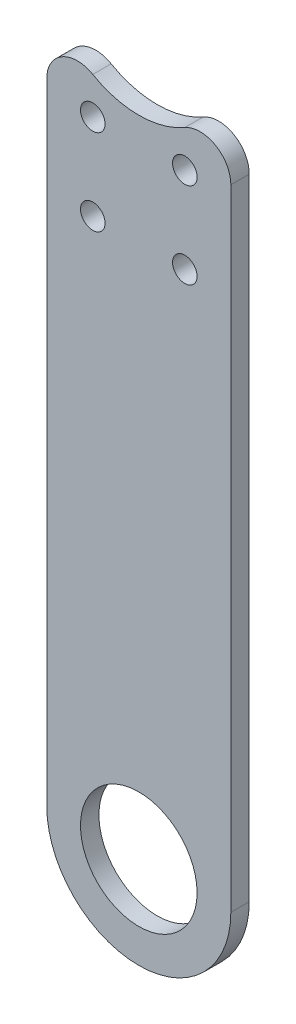
from build123d import *

# Parameters (mm, degrees)
SKETCH_1_R          = 9.5
EXTRUDE_1_DEPTH     = 3
FILLET_START        = -1
FILLET_2_DEPTH      = 5
SKETCH_2_R          = 2
CUT_EXTRUDE_1_DEPTH = 10


with BuildPart() as part:
    # 草图1 → 凸台-拉伸1 (new body)
    with BuildSketch(Plane.XY):
        with BuildLine():
            Line((-15, 0), (-15, -120))
            ThreePointArc((-15, -120), (0, -135), (15, -120))
            Line((15, -120), (15, 0))
            ThreePointArc((15, 0), (0, -15), (-15, 0))
        make_face()
        with Locations((0, -120)):
            Circle(SKETCH_1_R, mode=Mode.SUBTRACT)
    extrude(amount=EXTRUDE_1_DEPTH)

    # 圆角2: read off the stored shape, not the designer's step
    # 圆角2 outline → 圆角2 (cut)
    with BuildSketch(Plane.XY.offset(FILLET_START)):
        with BuildLine():
            Line((-15, 0), (-15, -17.320508076))
            ThreePointArc((-15, -17.320508076), (-12.5, -12.990381057), (-7.5, -12.990381057))
            ThreePointArc((-7.5, -12.990381057), (-12.990381057, -7.5), (-15, 0))
        make_face()
        with BuildLine():
            ThreePointArc((15, 0), (12.990381057, -7.5), (7.5, -12.990381057))
            ThreePointArc((7.5, -12.990381057), (12.5, -12.990381057), (15, -17.320508076))
            Line((15, -17.320508076), (15, 0))
        make_face()
    extrude(amount=FILLET_2_DEPTH, mode=Mode.SUBTRACT)

    # 草图2 → 切除-拉伸1 (cut)
    with BuildSketch(Plane.XY.offset(3)):
        with Locations((-7.5, -19)):
            Circle(SKETCH_2_R)
        with Locations((-7.5, -33)):
            Circle(SKETCH_2_R)
        with Locations((7.5, -33)):
            Circle(SKETCH_2_R)
        with Locations((7.5, -19)):
            Circle(SKETCH_2_R)
    extrude(amount=-CUT_EXTRUDE_1_DEPTH, mode=Mode.SUBTRACT)


solid = part.part
